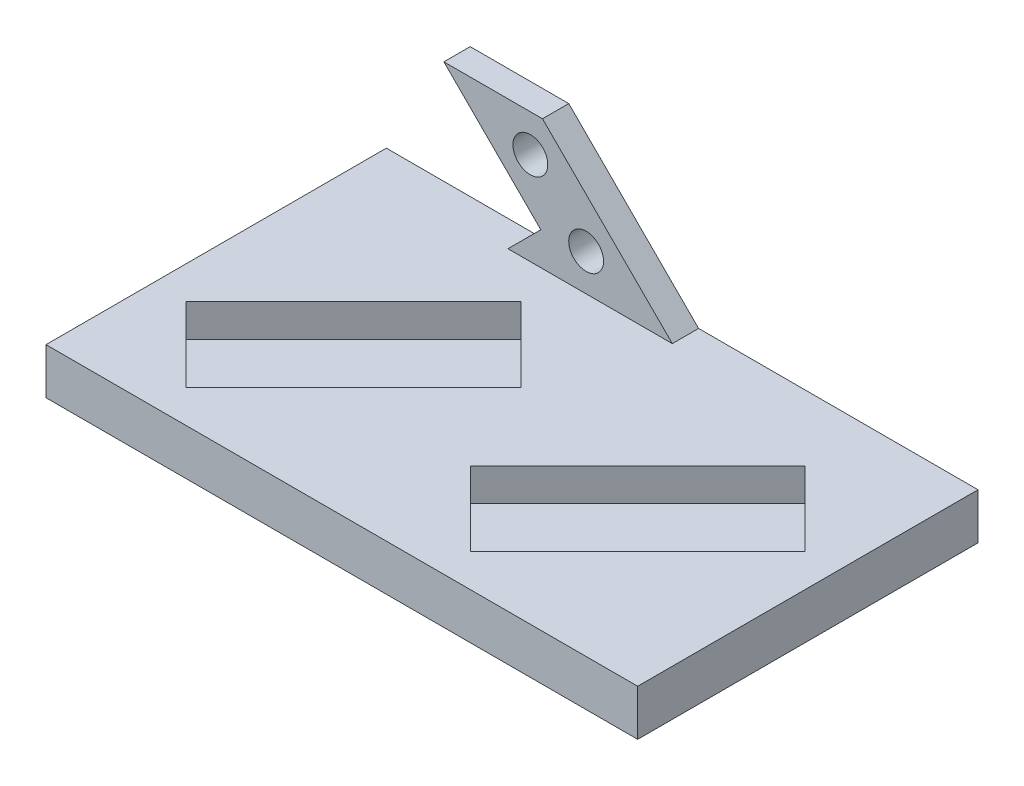
from build123d import *

# Parameters (mm, degrees)
SKETCH1_W           = 90
SKETCH1_H           = 51.769552622
BOSS_EXTRUDE1_DEPTH = 5
SKETCH5_R           = 2.65
BOSS_EXTRUDE2_DEPTH = 4
CHAMFER1_SIZE       = 10
CHAMFER1_SIZE2      = 7.071067812
SKETCH6_W           = 90
SKETCH6_H           = 51.769552622
BOSS_EXTRUDE3_DEPTH = 2


with BuildPart() as part:
    # Sketch1 → Boss-Extrude1 (new body)
    with BuildSketch(Plane(origin=(0, 0, 0), x_dir=(1, 0, 0), z_dir=(0, 1, 0))):
        with Locations((45, -25.884776311)):
            Rectangle(SKETCH1_W, SKETCH1_H)
        Polygon((16.313708499, -46.769552622), (5, -35.455844123), (30.455844123, -10), (41.769552622, -21.313708499), align=None, mode=Mode.SUBTRACT)
        Polygon((59.544155877, -46.769552622), (48.230447378, -35.455844123), (73.686291501, -10), (85, -21.313708499), align=None, mode=Mode.SUBTRACT)
    extrude(amount=BOSS_EXTRUDE1_DEPTH)

    # Sketch5 → Boss-Extrude2 (add)
    with BuildSketch(Plane(origin=(0, 0, 0), x_dir=(-1, 0, 0), z_dir=(0, 0, -1))):
        Polygon((-52.5, 0), (-27.751262658, 24.748737342), (-12.751262658, 24.748737342), (-37.5, 0), align=None)
        with Locations((-25.908116908, 19.091883092)):
            Circle(SKETCH5_R, mode=Mode.SUBTRACT)
        with Locations((-34.393398282, 10.606601718)):
            Circle(SKETCH5_R, mode=Mode.SUBTRACT)
    extrude(amount=-BOSS_EXTRUDE2_DEPTH)

    # Chamfer1
    chamfer1_edges = [part.edges().sort_by_distance(p)[0] for p in [
        (32.5, 5, 2),
    ]]
    chamfer1_side = [part.faces().sort_by_distance(p)[0] for p in [
        (45.087025644, 5, 25.465047734),
    ]]
    chamfer(chamfer1_edges, length=CHAMFER1_SIZE, length2=CHAMFER1_SIZE2, reference=chamfer1_side[0])

    # Sketch6 → Boss-Extrude3 (add)
    with BuildSketch(Plane.XZ):
        with Locations((45, 25.884776311)):
            Rectangle(SKETCH6_W, SKETCH6_H)
    extrude(amount=BOSS_EXTRUDE3_DEPTH)


solid = part.part
